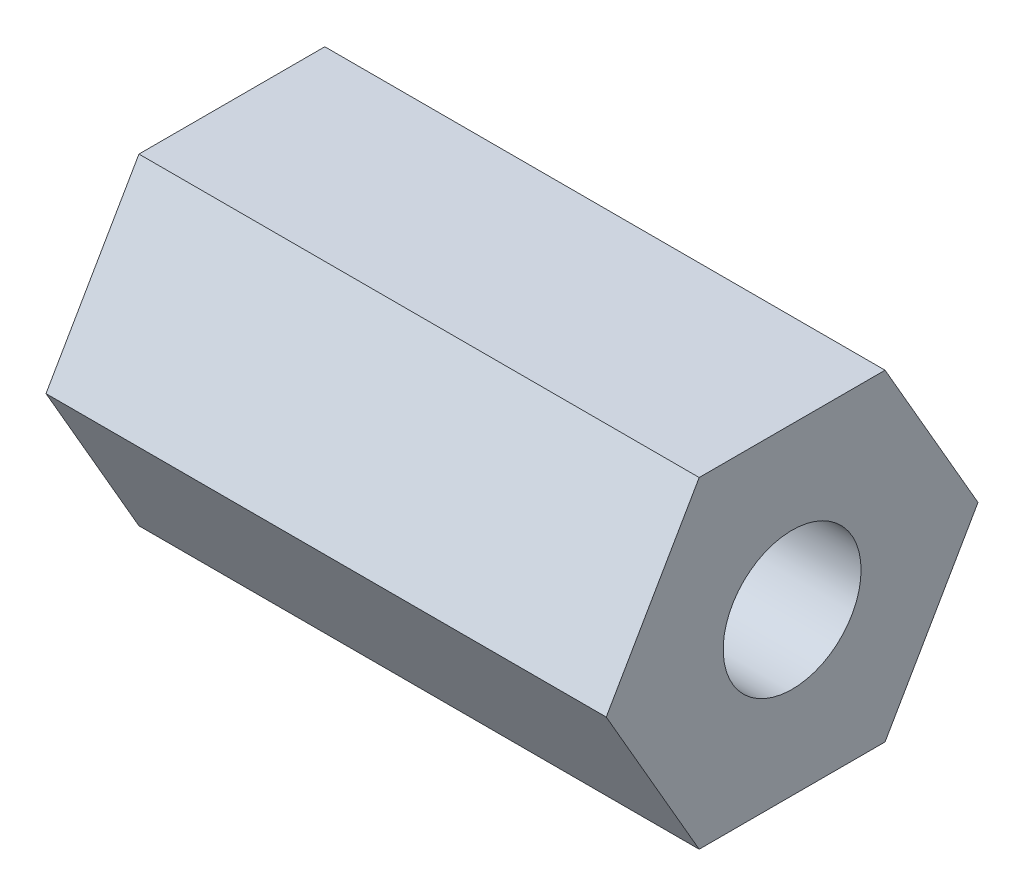
from build123d import *

# Parameters (mm, degrees)
BOSS_EXTRUDE1_DEPTH = 8.875
SKETCH2_R           = 1.0922
CUT_EXTRUDE1_DEPTH  = 10.69216823


with BuildPart() as part:
    # Sketch1 → Boss-Extrude1 (new body)
    with BuildSketch(Plane(origin=(0, 0, 0), x_dir=(0, 0, -1), z_dir=(1, 0, 0))):
        Polygon((2.944486373, 0), (1.472243186, 2.55), (-1.472243186, 2.55), (-2.944486373, 0), (-1.472243186, -2.55), (1.472243186, -2.55), align=None)
    extrude(amount=BOSS_EXTRUDE1_DEPTH)

    # Sketch2 → Cut-Extrude1 (cut, through all)
    with BuildSketch(Plane(origin=(8.875, 0, 0), x_dir=(0, 0, -1), z_dir=(1, 0, 0))):
        Circle(SKETCH2_R)
    extrude(amount=-CUT_EXTRUDE1_DEPTH, mode=Mode.SUBTRACT)


solid = part.part
